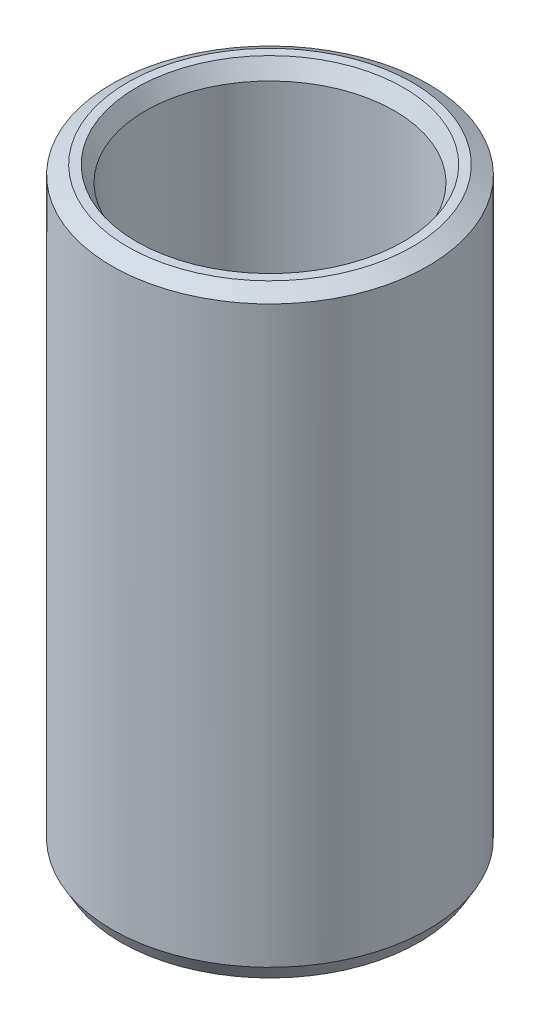
from build123d import *
from OCP.BRepFilletAPI import BRepFilletAPI_MakeChamfer

# Parameters (mm, degrees)
SKETCH1_R           = 60
BOSS_EXTRUDE1_DEPTH = 227.527161747
SKETCH2_R           = 47.27210775
CUT_EXTRUDE1_DEPTH  = 243.834530767
CHAMFER1_SIZE       = 3.421541805
CHAMFER1_SIZE2      = 5.926284247


with BuildPart() as part:
    # Sketch1 → Boss-Extrude1 (new body)
    with BuildSketch(Plane(origin=(0, 0, 0), x_dir=(1, 0, 0), z_dir=(0, 1, 0))):
        Circle(SKETCH1_R)
    extrude(amount=BOSS_EXTRUDE1_DEPTH)

    # Sketch2 → Cut-Extrude1 (cut, through all)
    with BuildSketch(Plane(origin=(0, 0, 0), x_dir=(1, 0, 0), z_dir=(0, 1, 0))):
        Circle(SKETCH2_R)
    extrude(amount=CUT_EXTRUDE1_DEPTH, mode=Mode.SUBTRACT)

    # Chamfer1: one chamfer whose edges measure the first distance from different faces: ONE call of the kernel's chamfer builder (chamfer() names one face for all edges)
    chamfer1_edges_1 = [part.edges().sort_by_distance(p)[0] for p in [
        (-47.27210775, 227.527161747, 0),
    ]]
    chamfer1_side_1 = [part.faces().sort_by_distance(p)[0] for p in [
        (-58.302943725, 227.527161747, 0),
    ]]
    chamfer1_edges_2 = [part.edges().sort_by_distance(p)[0] for p in [
        (-47.27210775, 0, 0),
    ]]
    chamfer1_side_2 = [part.faces().sort_by_distance(p)[0] for p in [
        (-47.27210775, 113.763580874, 0),
    ]]
    chamfer1_edges_3 = [part.edges().sort_by_distance(p)[0] for p in [
        (-60, 0, 0),
    ]]
    chamfer1_side_3 = [part.faces().sort_by_distance(p)[0] for p in [
        (-58.302943725, 0, 0),
    ]]
    chamfer1_edges_4 = [part.edges().sort_by_distance(p)[0] for p in [
        (-60, 227.527161747, 0),
    ]]
    chamfer1_side_4 = [part.faces().sort_by_distance(p)[0] for p in [
        (-60, 113.763580874, 0),
    ]]
    chamfer1 = BRepFilletAPI_MakeChamfer(part.part.solid().wrapped)
    for e in chamfer1_edges_1:
        chamfer1.Add(CHAMFER1_SIZE, CHAMFER1_SIZE2, e.wrapped, chamfer1_side_1[0].wrapped)  # the first distance lies on this face
    for e in chamfer1_edges_2:
        chamfer1.Add(CHAMFER1_SIZE, CHAMFER1_SIZE2, e.wrapped, chamfer1_side_2[0].wrapped)  # the first distance lies on this face
    for e in chamfer1_edges_3:
        chamfer1.Add(CHAMFER1_SIZE, CHAMFER1_SIZE2, e.wrapped, chamfer1_side_3[0].wrapped)  # the first distance lies on this face
    for e in chamfer1_edges_4:
        chamfer1.Add(CHAMFER1_SIZE, CHAMFER1_SIZE2, e.wrapped, chamfer1_side_4[0].wrapped)  # the first distance lies on this face
    add(Compound.cast(chamfer1.Shape()), mode=Mode.REPLACE)


solid = part.part
